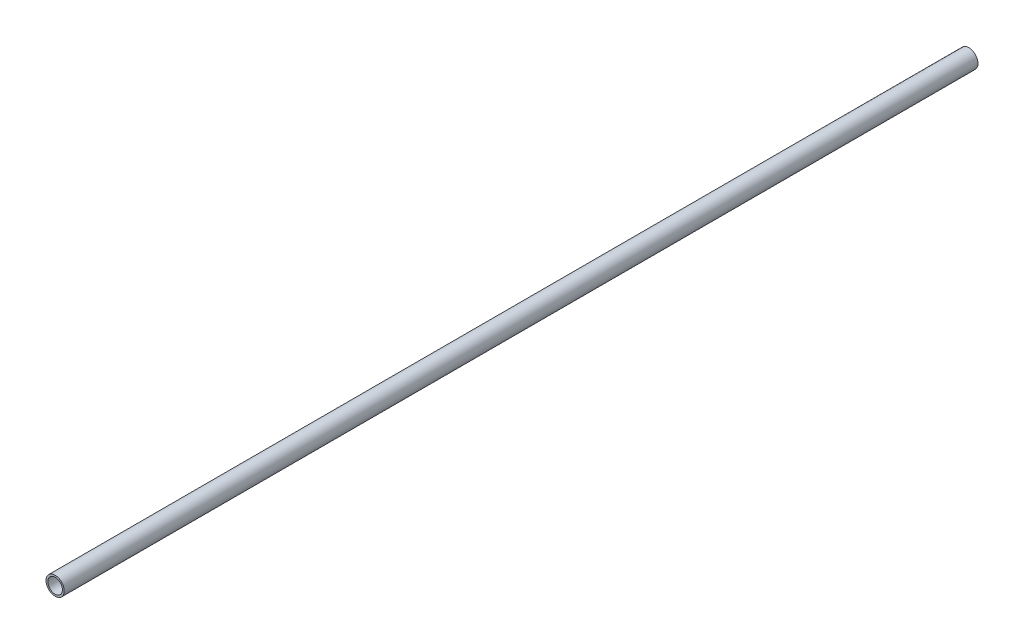
from build123d import *

# Parameters (mm, degrees)
SKETCH1_R           = 5
SKETCH1_R_2         = 4
BOSS_EXTRUDE1_DEPTH = 500


with BuildPart() as part:
    # Sketch1 → Boss-Extrude1 (new body)
    with BuildSketch(Plane.XY):
        Circle(SKETCH1_R)
        Circle(SKETCH1_R_2, mode=Mode.SUBTRACT)
    extrude(amount=BOSS_EXTRUDE1_DEPTH)


solid = part.part
